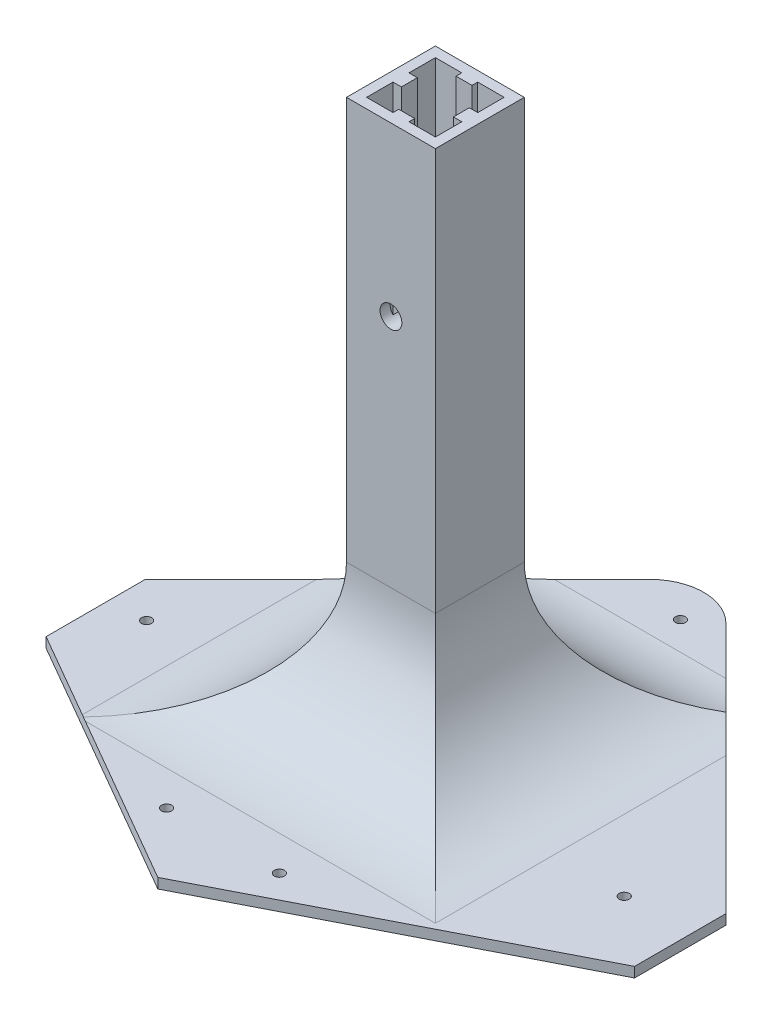
from build123d import *

# Parameters (mm, degrees)
SALIENTE_EXTRUIR1_DEPTH    = 3
CROQUIS2_W                 = 26.5
CROQUIS2_H                 = 26.5
CROQUIS2_W_2               = 20.5
CROQUIS2_H_2               = 20.5
SALIENTE_EXTRUIR2_DEPTH    = 160
REDONDEO1_R                = 40
CROQUIS3_W                 = 20.5
CROQUIS3_H                 = 20.5
SALIENTE_EXTRUIR3_DEPTH    = 12
CORTAR_EXTRUIR1_DEPTH      = 1209.003362467
CORTAR_EXTRUIR1_DEPTH_BACK = 1209.003362467
CROQUIS5_R                 = 4.5
CORTAR_EXTRUIR2_DEPTH      = 8
CROQUIS7_W                 = 4.75
CROQUIS7_H                 = 1.7
CROQUIS7_W_2               = 2.5
CROQUIS7_H_2               = 4.75
SALIENTE_EXTRUIR4_DEPTH    = 151
CORTAR_EXTRUIR4_DEPTH      = 219.224669206
CORTAR_EXTRUIR4_DEPTH_BACK = 219.224669206
CROQUIS8_R                 = 3.25
CROQUIS9_R                 = 1.5
CORTAR_EXTRUIR5_DEPTH      = 1210.16133073


with BuildPart() as part:
    # Croquis1 → Saliente-Extruir1 (new body)
    with BuildSketch(Plane(origin=(0, 0, 0), x_dir=(1, 0, 0), z_dir=(0, 1, 0))):
        with BuildLine():
            Line((-42.008082749, -1042.476659403), (-117.258933696, -1117.72751035))
            Line((-117.258933696, -1117.72751035), (-117.258933696, -1147.274817598))
            Line((-117.258933696, -1147.274817598), (-38.443578675, -1192.778884036))
            Line((-38.443578675, -1192.778884036), (55.597605894, -1144.689960025))
            Line((55.597605894, -1144.689960025), (55.597605894, -1117.454931048))
            Line((55.597605894, -1117.454931048), (-19.380665751, -1042.476659403))
            ThreePointArc((-19.380665751, -1042.476659403), (-30.69437425, -1037.790367902), (-42.008082749, -1042.476659403))
        make_face()
    extrude(amount=SALIENTE_EXTRUIR1_DEPTH)

    # Croquis2 → Saliente-Extruir2 (add)
    with BuildSketch(Plane(origin=(0, 3, 0), x_dir=(1, 0, 0), z_dir=(0, 1, 0))):
        with Locations((-38.472548844, -1110)):
            Rectangle(CROQUIS2_W, CROQUIS2_H)
        with Locations((-38.472548844, -1110)):
            Rectangle(CROQUIS2_W_2, CROQUIS2_H_2, mode=Mode.SUBTRACT)
    extrude(amount=SALIENTE_EXTRUIR2_DEPTH)

    # Redondeo1
    # the kernel refuses this fillet: 40 mm, written as the material it adds along each edge
    with BuildSketch(Plane(origin=(-25.222548844, 3, 1096.75), x_dir=(0, 0, -1), z_dir=(-1, 0, 0)), Plane(origin=(-51.722548844, 3, 1096.75), x_dir=(-1, 0, 0), z_dir=(0, 0, 1)), Plane(origin=(-51.722548844, 3, 1123.25), x_dir=(0, 0, 1), z_dir=(1, 0, 0)), Plane(origin=(-25.222548844, 3, 1123.25), x_dir=(1, 0, 0), z_dir=(0, 0, -1))) as redondeo1_piece_1:
        with BuildLine():
            CenterArc((REDONDEO1_R, -REDONDEO1_R), REDONDEO1_R, 90, 90)
            Line((0, -REDONDEO1_R), (-REDONDEO1_R * 0.02, -REDONDEO1_R))
            Line((-REDONDEO1_R * 0.02, -REDONDEO1_R), (-REDONDEO1_R * 0.02, REDONDEO1_R * 0.02))
            Line((-REDONDEO1_R * 0.02, REDONDEO1_R * 0.02), (REDONDEO1_R, REDONDEO1_R * 0.02))
            Line((REDONDEO1_R, REDONDEO1_R * 0.02), (REDONDEO1_R, 0))
        make_face()
    extrude(amount=26.5)
    with BuildSketch(Plane(origin=(-25.222548844, 3, 1123.25), x_dir=(1, 0, 0), z_dir=(0, 0, -1))) as redondeo1_piece_2a_section:
        with BuildLine():
            CenterArc((REDONDEO1_R, -REDONDEO1_R), REDONDEO1_R, 90, 90)
            Line((0, -REDONDEO1_R), (-REDONDEO1_R * 0.02, -REDONDEO1_R))
            Line((-REDONDEO1_R * 0.02, -REDONDEO1_R), (-REDONDEO1_R * 0.02, REDONDEO1_R * 0.02))
            Line((-REDONDEO1_R * 0.02, REDONDEO1_R * 0.02), (REDONDEO1_R, REDONDEO1_R * 0.02))
            Line((REDONDEO1_R, REDONDEO1_R * 0.02), (REDONDEO1_R, 0))
        make_face()
    redondeo1_piece_2a = extrude(amount=66.5, mode=Mode.PRIVATE)
    redondeo1_piece_2a = split(redondeo1_piece_2a, bisect_by=Plane(origin=(-0.706292993, 12.233154951, 1061.151032162), z_dir=(-0.7071067811865465, 0, 0.7071067811865487)), keep=Keep.TOP, mode=Mode.PRIVATE)
    redondeo1_piece_2a = split(redondeo1_piece_2a, bisect_by=Plane(origin=(-16.60527909, 12.233154951, 1096.75), z_dir=(0, 0, -1)), keep=Keep.TOP, mode=Mode.PRIVATE)
    with BuildSketch(Plane(origin=(14.777451156, 3, 1096.75), x_dir=(0, 0, -1), z_dir=(-1, 0, 0))) as redondeo1_piece_2b_section:
        with BuildLine():
            CenterArc((REDONDEO1_R, -REDONDEO1_R), REDONDEO1_R, 90, 90)
            Line((0, -REDONDEO1_R), (-REDONDEO1_R * 0.02, -REDONDEO1_R))
            Line((-REDONDEO1_R * 0.02, -REDONDEO1_R), (-REDONDEO1_R * 0.02, REDONDEO1_R * 0.02))
            Line((-REDONDEO1_R * 0.02, REDONDEO1_R * 0.02), (REDONDEO1_R, REDONDEO1_R * 0.02))
            Line((REDONDEO1_R, REDONDEO1_R * 0.02), (REDONDEO1_R, 0))
        make_face()
    redondeo1_piece_2b = extrude(amount=66.5, mode=Mode.PRIVATE)
    redondeo1_piece_2b = split(redondeo1_piece_2b, bisect_by=Plane(origin=(10.376418995, 12.233154951, 1072.233744149), z_dir=(-0.7071067811865465, 0, 0.7071067811865487)), keep=Keep.TOP, mode=Mode.PRIVATE)
    redondeo1_piece_2b = split(redondeo1_piece_2b, bisect_by=Plane(origin=(-25.222548844, 12.233154951, 1088.132730246), z_dir=(1, 0, 0)), keep=Keep.TOP, mode=Mode.PRIVATE)
    redondeo1_piece_2 = redondeo1_piece_2a & redondeo1_piece_2b
    add(redondeo1_piece_2)
    with BuildSketch(Plane(origin=(-51.722548844, 3, 1056.75), x_dir=(-1, 0, 0), z_dir=(0, 0, 1))) as redondeo1_piece_3a_section:
        with BuildLine():
            CenterArc((REDONDEO1_R, -REDONDEO1_R), REDONDEO1_R, 90, 90)
            Line((0, -REDONDEO1_R), (-REDONDEO1_R * 0.02, -REDONDEO1_R))
            Line((-REDONDEO1_R * 0.02, -REDONDEO1_R), (-REDONDEO1_R * 0.02, REDONDEO1_R * 0.02))
            Line((-REDONDEO1_R * 0.02, REDONDEO1_R * 0.02), (REDONDEO1_R, REDONDEO1_R * 0.02))
            Line((REDONDEO1_R, REDONDEO1_R * 0.02), (REDONDEO1_R, 0))
        make_face()
    redondeo1_piece_3a = extrude(amount=66.5, mode=Mode.PRIVATE)
    redondeo1_piece_3a = split(redondeo1_piece_3a, bisect_by=Plane(origin=(-68.586290047, 13.081785703, 1069.0548667), z_dir=(0.70710678118655, 0, 0.7071067811865451)), keep=Keep.TOP, mode=Mode.PRIVATE)
    redondeo1_piece_3a = split(redondeo1_piece_3a, bisect_by=Plane(origin=(-58.896332092, 13.081785703, 1096.75), z_dir=(0, 0, -1)), keep=Keep.TOP, mode=Mode.PRIVATE)
    with BuildSketch(Plane(origin=(-25.222548844, 3, 1096.75), x_dir=(0, 0, -1), z_dir=(-1, 0, 0))) as redondeo1_piece_3b_section:
        with BuildLine():
            CenterArc((REDONDEO1_R, -REDONDEO1_R), REDONDEO1_R, 90, 90)
            Line((0, -REDONDEO1_R), (-REDONDEO1_R * 0.02, -REDONDEO1_R))
            Line((-REDONDEO1_R * 0.02, -REDONDEO1_R), (-REDONDEO1_R * 0.02, REDONDEO1_R * 0.02))
            Line((-REDONDEO1_R * 0.02, REDONDEO1_R * 0.02), (REDONDEO1_R, REDONDEO1_R * 0.02))
            Line((REDONDEO1_R, REDONDEO1_R * 0.02), (REDONDEO1_R, 0))
        make_face()
    redondeo1_piece_3b = extrude(amount=66.5, mode=Mode.PRIVATE)
    redondeo1_piece_3b = split(redondeo1_piece_3b, bisect_by=Plane(origin=(-79.417682144, 13.081785703, 1079.886258797), z_dir=(0.70710678118655, 0, 0.7071067811865451)), keep=Keep.TOP, mode=Mode.PRIVATE)
    redondeo1_piece_3b = split(redondeo1_piece_3b, bisect_by=Plane(origin=(-51.722548844, 13.081785703, 1089.576216751), z_dir=(-1, 0, 0)), keep=Keep.TOP, mode=Mode.PRIVATE)
    redondeo1_piece_3 = redondeo1_piece_3a & redondeo1_piece_3b
    add(redondeo1_piece_3)
    with BuildSketch(Plane(origin=(-51.722548844, 3, 1096.75), x_dir=(-1, 0, 0), z_dir=(0, 0, 1))) as redondeo1_piece_4a_section:
        with BuildLine():
            CenterArc((REDONDEO1_R, -REDONDEO1_R), REDONDEO1_R, 90, 90)
            Line((0, -REDONDEO1_R), (-REDONDEO1_R * 0.02, -REDONDEO1_R))
            Line((-REDONDEO1_R * 0.02, -REDONDEO1_R), (-REDONDEO1_R * 0.02, REDONDEO1_R * 0.02))
            Line((-REDONDEO1_R * 0.02, REDONDEO1_R * 0.02), (REDONDEO1_R, REDONDEO1_R * 0.02))
            Line((REDONDEO1_R, REDONDEO1_R * 0.02), (REDONDEO1_R, 0))
        make_face()
    redondeo1_piece_4a = extrude(amount=66.5, mode=Mode.PRIVATE)
    redondeo1_piece_4a = split(redondeo1_piece_4a, bisect_by=Plane(origin=(-76.640371014, 12.056420545, 1170.725955696), z_dir=(0.4999999999999994, 0, -0.866025403784439)), keep=Keep.TOP, mode=Mode.PRIVATE)
    redondeo1_piece_4a = split(redondeo1_piece_4a, bisect_by=Plane(origin=(-60.776383391, 12.056420545, 1123.25), z_dir=(0, 0, 1)), keep=Keep.TOP, mode=Mode.PRIVATE)
    with BuildSketch(Plane(origin=(-91.722548844, 3, 1123.25), x_dir=(0, 0, 1), z_dir=(1, 0, 0))) as redondeo1_piece_4b_section:
        with BuildLine():
            CenterArc((REDONDEO1_R, -REDONDEO1_R), REDONDEO1_R, 90, 90)
            Line((0, -REDONDEO1_R), (-REDONDEO1_R * 0.02, -REDONDEO1_R))
            Line((-REDONDEO1_R * 0.02, -REDONDEO1_R), (-REDONDEO1_R * 0.02, REDONDEO1_R * 0.02))
            Line((-REDONDEO1_R * 0.02, REDONDEO1_R * 0.02), (REDONDEO1_R, REDONDEO1_R * 0.02))
            Line((REDONDEO1_R, REDONDEO1_R * 0.02), (REDONDEO1_R, 0))
        make_face()
    redondeo1_piece_4b = extrude(amount=66.5, mode=Mode.PRIVATE)
    redondeo1_piece_4b = split(redondeo1_piece_4b, bisect_by=Plane(origin=(-89.588337219, 12.056415941, 1163.250443922), z_dir=(0.4999999999999994, 0, -0.866025403784439)), keep=Keep.TOP, mode=Mode.PRIVATE)
    redondeo1_piece_4b = split(redondeo1_piece_4b, bisect_by=Plane(origin=(-51.722548844, 12.056415941, 1132.303830155), z_dir=(-1, 0, 0)), keep=Keep.TOP, mode=Mode.PRIVATE)
    redondeo1_piece_4 = redondeo1_piece_4a & redondeo1_piece_4b
    add(redondeo1_piece_4)
    with BuildSketch(Plane(origin=(-51.722548844, 3, 1123.25), x_dir=(0, 0, 1), z_dir=(1, 0, 0))) as redondeo1_piece_5a_section:
        with BuildLine():
            CenterArc((REDONDEO1_R, -REDONDEO1_R), REDONDEO1_R, 90, 90)
            Line((0, -REDONDEO1_R), (-REDONDEO1_R * 0.02, -REDONDEO1_R))
            Line((-REDONDEO1_R * 0.02, -REDONDEO1_R), (-REDONDEO1_R * 0.02, REDONDEO1_R * 0.02))
            Line((-REDONDEO1_R * 0.02, REDONDEO1_R * 0.02), (REDONDEO1_R, REDONDEO1_R * 0.02))
            Line((REDONDEO1_R, REDONDEO1_R * 0.02), (REDONDEO1_R, 0))
        make_face()
    redondeo1_piece_5a = extrude(amount=66.5, mode=Mode.PRIVATE)
    redondeo1_piece_5a = split(redondeo1_piece_5a, bisect_by=Plane(origin=(-25.222548844, 12.055804571, 1132.305804571), z_dir=(1, 0, 0)), keep=Keep.TOP, mode=Mode.PRIVATE)
    with BuildSketch(Plane(origin=(-25.222548844, 3, 1163.25), x_dir=(1, 0, 0), z_dir=(0, 0, -1))) as redondeo1_piece_5b_section:
        with BuildLine():
            CenterArc((REDONDEO1_R, -REDONDEO1_R), REDONDEO1_R, 90, 90)
            Line((0, -REDONDEO1_R), (-REDONDEO1_R * 0.02, -REDONDEO1_R))
            Line((-REDONDEO1_R * 0.02, -REDONDEO1_R), (-REDONDEO1_R * 0.02, REDONDEO1_R * 0.02))
            Line((-REDONDEO1_R * 0.02, REDONDEO1_R * 0.02), (REDONDEO1_R, REDONDEO1_R * 0.02))
            Line((REDONDEO1_R, REDONDEO1_R * 0.02), (REDONDEO1_R, 0))
        make_face()
    redondeo1_piece_5b = extrude(amount=66.5, mode=Mode.PRIVATE)
    redondeo1_piece_5b = split(redondeo1_piece_5b, bisect_by=Plane(origin=(-16.166744273, 12.055804571, 1123.25), z_dir=(0, 0, 1)), keep=Keep.TOP, mode=Mode.PRIVATE)
    redondeo1_piece_5 = redondeo1_piece_5a & redondeo1_piece_5b
    add(redondeo1_piece_5)

    # Croquis3 → Saliente-Extruir3 (add)
    with BuildSketch(Plane(origin=(0, 0, 0), x_dir=(1, 0, 0), z_dir=(0, 1, 0))):
        with Locations((-38.472548844, -1110)):
            Rectangle(CROQUIS3_W, CROQUIS3_H)
    extrude(amount=SALIENTE_EXTRUIR3_DEPTH)

    # Croquis5 → Cortar-Extruir1 (cut, two sides: drawn at the far end of the back side and taken through both)
    with BuildSketch(Plane(origin=(0, 12, 0), x_dir=(1, 0, 0), z_dir=(0, 1, 0)).offset(-CORTAR_EXTRUIR1_DEPTH_BACK)):
        with Locations(Location((-38.472548844, -1110, 0), (0, 0, 270))):
            Circle(CROQUIS5_R)
    extrude(amount=CORTAR_EXTRUIR1_DEPTH + CORTAR_EXTRUIR1_DEPTH_BACK, mode=Mode.SUBTRACT)

    # Croquis6 → Cortar-Extruir2 (cut)
    with BuildSketch(Plane(origin=(0, 12, 0), x_dir=(1, 0, 0), z_dir=(0, 1, 0))):
        Polygon((-38.472548844, -1102.148036339), (-45.272548844, -1106.07401817), (-45.272548844, -1113.92598183), (-38.472548844, -1117.851963661), (-31.672548844, -1113.92598183), (-31.672548844, -1106.07401817), align=None)
    extrude(amount=-CORTAR_EXTRUIR2_DEPTH, mode=Mode.SUBTRACT)

    # Croquis7 → Saliente-Extruir4 (add)
    with BuildSketch(Plane(origin=(0, 12, 0), x_dir=(1, 0, 0), z_dir=(0, 1, 0))):
        with Locations((-38.472548844, -1100.6)):
            Rectangle(CROQUIS7_W, CROQUIS7_H)
        with Locations((-47.472548844, -1110)):
            Rectangle(CROQUIS7_W_2, CROQUIS7_H_2)
        with Locations((-38.472548844, -1119.4)):
            Rectangle(CROQUIS7_W, CROQUIS7_H)
        with Locations((-29.472548844, -1110)):
            Rectangle(CROQUIS7_W_2, CROQUIS7_H_2)
    extrude(amount=SALIENTE_EXTRUIR4_DEPTH)

    # Croquis8 → Cortar-Extruir4 (cut, two sides: drawn at the far end of the back side and taken through both)
    with BuildSketch(Plane.XY.offset(1123.25).offset(-CORTAR_EXTRUIR4_DEPTH_BACK)):
        with Locations((-38.472548844, 113)):
            Circle(CROQUIS8_R)
    extrude(amount=CORTAR_EXTRUIR4_DEPTH + CORTAR_EXTRUIR4_DEPTH_BACK, mode=Mode.SUBTRACT)

    # Croquis9 → Cortar-Extruir5 (cut, through all)
    with BuildSketch(Plane(origin=(0, 3, 0), x_dir=(1, 0, 0), z_dir=(0, 1, 0))):
        with Locations(Location((-27.090664648, -1048.332987398, 0), (0, 0, 270))):
            Circle(CROQUIS9_R)
        with Locations(Location((-106.428532016, -1128.141321277, 0), (0, 0, 270))):
            Circle(CROQUIS9_R)
        with Locations(Location((-55.03760272, -1173.573045968, 0), (0, 0, 270))):
            Circle(CROQUIS9_R)
        with Locations(Location((-21.412673883, -1173.573045968, 0), (0, 0, 270))):
            Circle(CROQUIS9_R)
        with Locations(Location((35.966198897, -1128.141321277, 0), (0, 0, 270))):
            Circle(CROQUIS9_R)
    extrude(amount=-CORTAR_EXTRUIR5_DEPTH, mode=Mode.SUBTRACT)


solid = part.part
